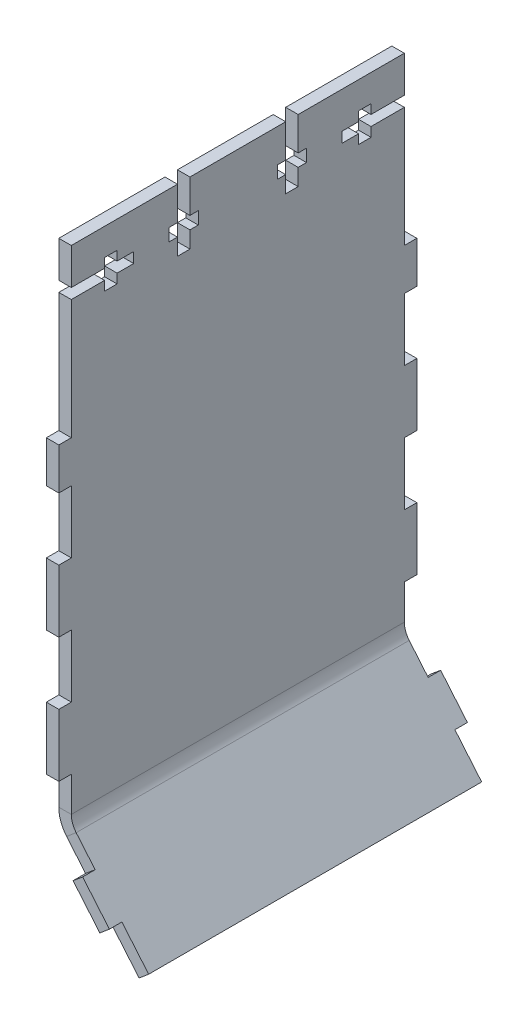
from build123d import *

# Parameters (mm, degrees)
BRIDA_BASE1_DEPTH       = 80
CROQUIS13_W             = 3
CROQUIS13_H             = 10
CROQUIS13_H_2           = 15
SALIENTE_EXTRUIR2_DEPTH = 3
CROQUIS14_W             = 3
CROQUIS14_H             = 10
CROQUIS14_H_2           = 15
SALIENTE_EXTRUIR3_DEPTH = 3
CORTAR_EXTRUIR1_DEPTH   = 10


# Sheet-metal steps are written as plain solids
with BuildPart() as part:
    # Croquis7 → Brida base1 (new body)
    with BuildSketch(Plane.XY):
        with BuildLine():
            Line((3, 29.270313854), (3, 0))
            Line((3, 0), (3, -89.088238126))
            ThreePointArc((3, -89.088238126), (3.301536896, -90.798338842), (4.169777784, -92.302176174))
            Line((4.169777784, -92.302176174), (21.58176162, -113.052970465))
            Line((21.58176162, -113.052970465), (19.283628291, -114.981333294))
            Line((19.283628291, -114.981333294), (1.871644455, -94.230539003))
            ThreePointArc((1.871644455, -94.230539003), (0.482459034, -91.824399272), (0, -89.088238126))
            Line((0, -89.088238126), (0, 0))
            Line((0, 0), (0, 29.270313854))
            Line((0, 29.270313854), (3, 29.270313854))
        make_face()
    extrude(amount=BRIDA_BASE1_DEPTH)

    # Croquis13 → Saliente-Extruir2 (add)
    with BuildSketch(Plane.XY.offset(80)):
        with Locations((1.5, -15.729686146)):
            Rectangle(CROQUIS13_W, CROQUIS13_H)
        Polygon((12.855752194, -107.320888862), (15.153885523, -105.392526033), (8.726009426, -97.732081602), (6.427876097, -99.660444431), align=None)
        with Locations((1.5, -43.229686146)):
            Rectangle(CROQUIS13_W, CROQUIS13_H_2)
        with Locations((1.5, -73.229686146)):
            Rectangle(CROQUIS13_W, CROQUIS13_H_2)
    extrude(amount=SALIENTE_EXTRUIR2_DEPTH)

    # Croquis14 → Saliente-Extruir3 (add)
    with BuildSketch(Plane(origin=(0, 0, 0), x_dir=(-1, 0, 0), z_dir=(0, 0, -1))):
        with Locations((-1.5, -15.729686146)):
            Rectangle(CROQUIS14_W, CROQUIS14_H)
        Polygon((-15.153885523, -105.392526033), (-12.855752194, -107.320888862), (-6.427876097, -99.660444431), (-8.726009426, -97.732081602), align=None)
        with Locations((-1.5, -43.229686146)):
            Rectangle(CROQUIS14_W, CROQUIS14_H_2)
        with Locations((-1.5, -73.229686146)):
            Rectangle(CROQUIS14_W, CROQUIS14_H_2)
    extrude(amount=SALIENTE_EXTRUIR3_DEPTH)

    # Croquis15 → Cortar-Extruir1 (cut)
    with BuildSketch(Plane.ZY):
        Polygon((8, 20.520313854), (0, 20.520313854), (0, 18.020313854), (8, 18.020313854), (8, 15.770313854), (11, 15.770313854), (11, 18.020313854), (15, 18.020313854), (15, 20.520313854), (11, 20.520313854), (11, 22.770313854), (8, 22.770313854), align=None)
        Polygon((80, 18.020313854), (80, 20.520313854), (72, 20.520313854), (72, 22.770313854), (69, 22.770313854), (69, 20.520313854), (65, 20.520313854), (65, 18.020313854), (69, 18.020313854), (69, 15.770313854), (72, 15.770313854), (72, 18.020313854), align=None)
        Polygon((54.5, 29.270313854), (51.5, 29.270313854), (51.5, 21.270313854), (49.5, 21.270313854), (49.5, 18.270313854), (51.5, 18.270313854), (51.5, 14.270313854), (54.5, 14.270313854), (54.5, 18.270313854), (56.5, 18.270313854), (56.5, 21.270313854), (54.5, 21.270313854), align=None)
        Polygon((28.5, 29.270313854), (25.5, 29.270313854), (25.5, 21.270313854), (23.5, 21.270313854), (23.5, 18.270313854), (25.5, 18.270313854), (25.5, 14.270313854), (28.5, 14.270313854), (28.5, 18.270313854), (30.5, 18.270313854), (30.5, 21.270313854), (28.5, 21.270313854), align=None)
    extrude(amount=-CORTAR_EXTRUIR1_DEPTH, mode=Mode.SUBTRACT)


solid = part.part
